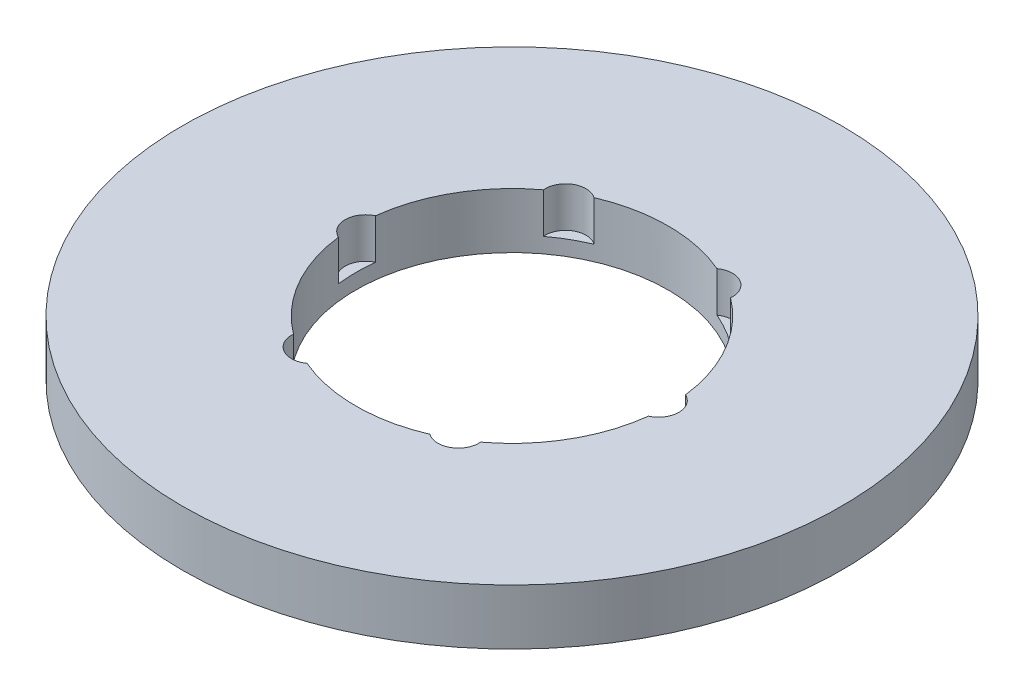
from build123d import *

# Parameters (mm, degrees)
SKETCH1_R           = 95
BOSS_EXTRUDE1_DEPTH = 16
SKETCH2_R           = 45
CUT_EXTRUDE1_DEPTH  = 136.299667405
SKETCH3_R           = 5.879997647
CUT_EXTRUDE2_DEPTH  = 11.623032419
CIRPATTERN1_COUNT   = 6


with BuildPart() as part:
    # Sketch1 → Boss-Extrude1 (new body)
    with BuildSketch(Plane(origin=(0, 0, 0), x_dir=(1, 0, 0), z_dir=(0, 1, 0))):
        Circle(SKETCH1_R)
    extrude(amount=BOSS_EXTRUDE1_DEPTH)

    # Sketch2 → Cut-Extrude1 (cut, through all)
    with BuildSketch(Plane(origin=(0, 0, 0), x_dir=(1, 0, 0), z_dir=(0, 1, 0))):
        Circle(SKETCH2_R)
    extrude(amount=CUT_EXTRUDE1_DEPTH, mode=Mode.SUBTRACT)

    # Sketch3 → Cut-Extrude2 (cut)
    with BuildSketch(Plane(origin=(0, 16, 0), x_dir=(1, 0, 0), z_dir=(0, 1, 0))):
        with Locations((-42.22550746, 0)):
            Circle(SKETCH3_R)
    cut_extrude2 = extrude(amount=-CUT_EXTRUDE2_DEPTH, mode=Mode.SUBTRACT)

    # CirPattern1: Cut-Extrude2 ×6 about axis
    cirpattern1_axis = Axis((0, 0, 0), (0, 1, 0))
    for i in range(1, CIRPATTERN1_COUNT):
        add(cut_extrude2.rotate(cirpattern1_axis, i * 360 / CIRPATTERN1_COUNT), mode=Mode.SUBTRACT)


solid = part.part
